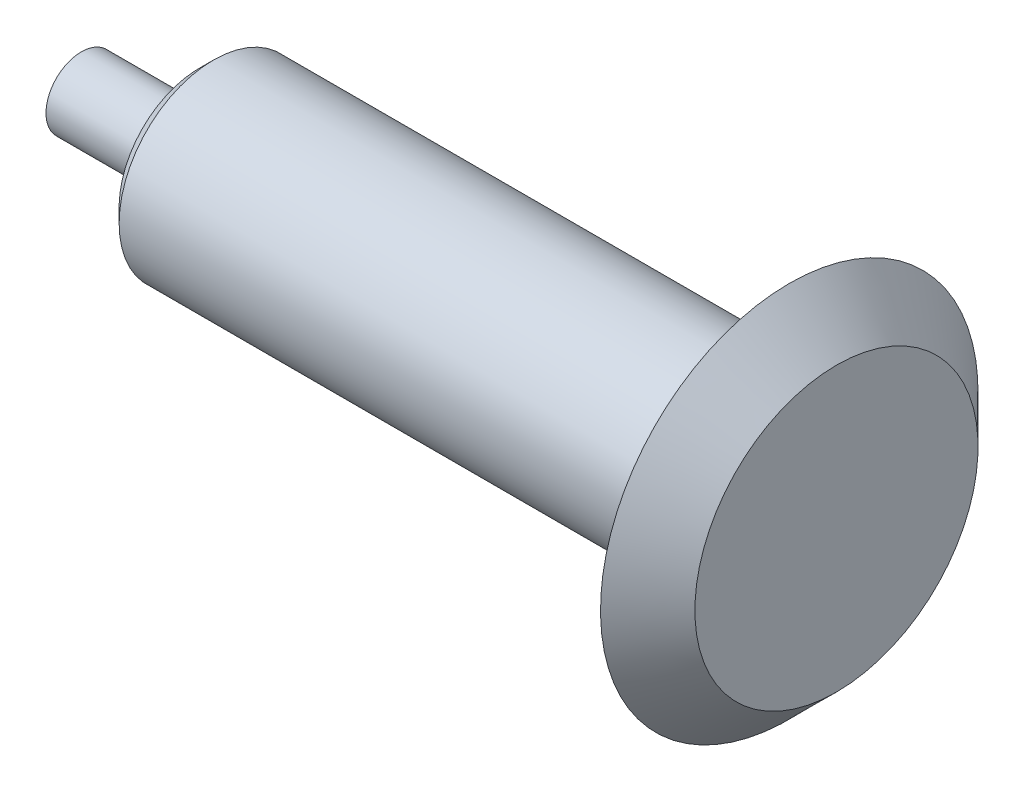
from build123d import *

# Parameters (mm, degrees)
CHAMFER1_SIZE = 10
CHAMFER2_SIZE = 3


with BuildPart() as part:
    # Sketch1 → Revolve1 (revolve)
    with BuildSketch(Plane.XY):
        Polygon((-80, 0), (-80, 7.5), (-55, 7.5), (-55, 20), (62.928932188, 20), (70, 27.071067812), (70, 40), (80, 40), (80, 0), align=None)
    revolve(axis=Axis((80, 0, 0), (-1, 0, 0)))

    # Chamfer1
    chamfer1_edges = [part.edges().sort_by_distance(p)[0] for p in [
        (80, -40, 0),
    ]]
    chamfer(chamfer1_edges, length=CHAMFER1_SIZE - 0.0001)  # a hair under: the kernel refuses the full size

    # Chamfer2
    chamfer2_edges = [part.edges().sort_by_distance(p)[0] for p in [
        (-55, -20, 0),
    ]]
    chamfer(chamfer2_edges, length=CHAMFER2_SIZE)


solid = part.part
